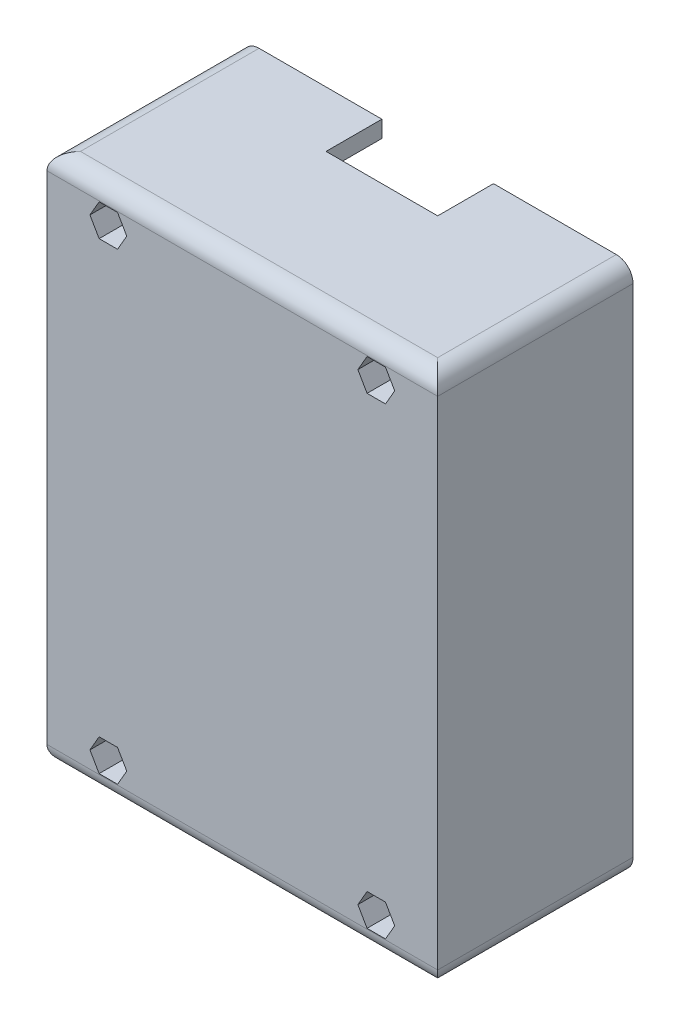
from build123d import *

# Parameters (mm, degrees)
SKETCH_1_W               = 35
SKETCH_1_H               = 95
EXTRUDE_1_DEPTH          = 60
CUT_EXTRUDE_1_DEPTH      = 32
SKETCH_5_R               = 1.6
CUT_EXTRUDE_2_DEPTH      = 85.150163399
SKETCH_6_W               = 35
SKETCH_6_H               = 95
EXTRUDE_2_DEPTH          = 5
SKETCH_7_W               = 35
SKETCH_7_H               = 95
EXTRUDE_3_DEPTH          = 5
SHELL_START              = -17.5
SHELL_1_DEPTH            = 32
SKETCH_8_W               = 8
SKETCH_8_H               = 7
SKETCH_8_R               = 1.530060118
EXTRUDE_4_DEPTH          = 5
SKETCH_9_W               = 2.5
SKETCH_9_H               = 5.5
CUT_EXTRUDE_3_DEPTH      = 7.5
SKETCH_10_W              = 2.5
SKETCH_10_H              = 5.5
CUT_EXTRUDE_4_DEPTH      = 8
SKETCH_11_W              = 5
SKETCH_11_H              = 5
EXTRUDE_5_DEPTH          = 16
CUT_EXTRUDE_5_DEPTH      = 40
CUT_EXTRUDE_5_DEPTH_BACK = 10
SKETCH_12_R              = 7
EXTRUDE_6_DEPTH          = 5
EXTRUDE_7_DEPTH          = 5
EXTRUDE_8_REACH          = 115.997
SKETCH_16_W              = 7
SKETCH_16_H              = 7
CUT_EXTRUDE_6_REACH      = 89.785
SKETCH_20_W              = 5.5
SKETCH_20_H              = 2.903315034
CUT_EXTRUDE_7_DEPTH      = 7
SKETCH_21_R              = 1.6
CUT_EXTRUDE_8_DEPTH      = 107.975985533
SKETCH_22_W              = 4
SKETCH_22_H              = 18
CUT_EXTRUDE_9_DEPTH      = 7
SKETCH_23_W              = 20
SKETCH_23_H              = 10
CUT_EXTRUDE_10_DEPTH     = 10
FILLET_3_R               = 3


# Read off the part's stored shape, not the designer's step: 抽壳1
with BuildPart() as part:
    # 草图1 → 凸台-拉伸1 (new body)
    with BuildSketch(Plane(origin=(0, 0, 0), x_dir=(0, 0, -1), z_dir=(1, 0, 0))):
        Rectangle(SKETCH_1_W, SKETCH_1_H)
    extrude(amount=EXTRUDE_1_DEPTH)

    # 草图4 → 切除-拉伸1 (cut)
    with BuildSketch(Plane.XY.offset(17.5)):
        Polygon((50.7, 41.5), (52.35, 38.642116168), (55.65, 38.642116168), (57.3, 41.5), (55.65, 44.357883832), (52.35, 44.357883832), align=None)
        Polygon((9.3, 41.5), (7.65, 44.357883832), (4.35, 44.357883832), (2.7, 41.5), (4.35, 38.642116168), (7.65, 38.642116168), align=None)
        Polygon((9.3, -41.5), (7.65, -38.642116168), (4.35, -38.642116168), (2.7, -41.5), (4.35, -44.357883832), (7.65, -44.357883832), align=None)
        Polygon((50.7, -41.5), (52.35, -44.357883832), (55.65, -44.357883832), (57.3, -41.5), (55.65, -38.642116168), (52.35, -38.642116168), align=None)
    extrude(amount=-CUT_EXTRUDE_1_DEPTH, mode=Mode.SUBTRACT)

    # 草图5 → 切除-拉伸2 (cut, through all)
    with BuildSketch(Plane.XY.offset(17.5)):
        with Locations((54, 41.5)):
            Circle(SKETCH_5_R)
        with Locations((6, 41.5)):
            Circle(SKETCH_5_R)
        with Locations((54, -41.5)):
            Circle(SKETCH_5_R)
        with Locations((6, -41.5)):
            Circle(SKETCH_5_R)
    extrude(amount=-CUT_EXTRUDE_2_DEPTH, mode=Mode.SUBTRACT)

    # 草图6 → 凸台-拉伸2 (add)
    with BuildSketch(Plane.ZY):
        Rectangle(SKETCH_6_W, SKETCH_6_H)
    extrude(amount=EXTRUDE_2_DEPTH)

    # 草图7 → 凸台-拉伸3 (add)
    with BuildSketch(Plane(origin=(60, 0, 0), x_dir=(0, 0, -1), z_dir=(1, 0, 0))):
        Rectangle(SKETCH_7_W, SKETCH_7_H)
    extrude(amount=EXTRUDE_3_DEPTH)

    # 抽壳1 outline → 抽壳1 (cut)
    with BuildSketch(Plane.XY.offset(SHELL_START)):
        Polygon((59.032050808, -44.5), (62, -44.5), (62, 44.5), (59.032050808, 44.5), (60.764101615, 41.5), (57.382050808, 35.642116168), (50.617949192, 35.642116168), (47.235898385, 41.5), (48.967949192, 44.5), (11.032050808, 44.5), (12.764101615, 41.5), (9.382050808, 35.642116168), (2.617949192, 35.642116168), (-0.764101615, 41.5), (0.967949192, 44.5), (-2, 44.5), (-2, -44.5), (0.967949192, -44.5), (-0.764101615, -41.5), (2.617949192, -35.642116168), (9.382050808, -35.642116168), (12.764101615, -41.5), (11.032050808, -44.5), (48.967949192, -44.5), (47.235898385, -41.5), (50.617949192, -35.642116168), (57.382050808, -35.642116168), (60.764101615, -41.5), align=None)
    extrude(amount=SHELL_1_DEPTH, mode=Mode.SUBTRACT)

    # 草图8 → 凸台-拉伸4 (add)
    # profile 1 of 4: a face of its own
    with BuildSketch(Plane(origin=(0, 0, -1.5), x_dir=(-1, 0, 0), z_dir=(0, 0, -1))):
        with Locations((-2, 32.5)):
            Rectangle(SKETCH_8_W, SKETCH_8_H)
        with Locations((-2, 32.5)):
            Circle(SKETCH_8_R, mode=Mode.SUBTRACT)
    # profile 2 of 4: a face of its own
    with BuildSketch(Plane(origin=(0, 0, -1.5), x_dir=(-1, 0, 0), z_dir=(0, 0, -1))):
        with Locations((-58, 32.5)):
            Rectangle(SKETCH_8_W, SKETCH_8_H)
        with Locations(Location((-58, 32.5, 0), (0, 0, 180))):
            Circle(SKETCH_8_R, mode=Mode.SUBTRACT)
    # profile 3 of 4: a face of its own
    with BuildSketch(Plane(origin=(0, 0, -1.5), x_dir=(-1, 0, 0), z_dir=(0, 0, -1))):
        with Locations((-2, -13.5)):
            Rectangle(SKETCH_8_W, SKETCH_8_H)
        with Locations(Location((-2, -13.5, 0), (0, 0, 180))):
            Circle(SKETCH_8_R, mode=Mode.SUBTRACT)
    # profile 4 of 4: a face of its own
    with BuildSketch(Plane(origin=(0, 0, -1.5), x_dir=(-1, 0, 0), z_dir=(0, 0, -1))):
        with Locations((-58, -13.5)):
            Rectangle(SKETCH_8_W, SKETCH_8_H)
        with Locations((-58, -13.5)):
            Circle(SKETCH_8_R, mode=Mode.SUBTRACT)
    extrude(amount=-EXTRUDE_4_DEPTH)

    # 草图9 → 切除-拉伸3 (cut)
    with BuildSketch(Plane.ZY.offset(-54)):
        with Locations((1.55, 32.5)):
            Rectangle(SKETCH_9_W, SKETCH_9_H)
        with Locations((1.55, -13.5)):
            Rectangle(SKETCH_9_W, SKETCH_9_H)
    extrude(amount=-CUT_EXTRUDE_3_DEPTH, mode=Mode.SUBTRACT)

    # 草图10 → 切除-拉伸4 (cut)
    with BuildSketch(Plane(origin=(6, 0, 0), x_dir=(0, 0, -1), z_dir=(1, 0, 0))):
        with Locations((-1.55, 32.5)):
            Rectangle(SKETCH_10_W, SKETCH_10_H)
        with Locations((-1.55, -13.5)):
            Rectangle(SKETCH_10_W, SKETCH_10_H)
    extrude(amount=-CUT_EXTRUDE_4_DEPTH, mode=Mode.SUBTRACT)

    # 草图11 → 凸台-拉伸5 (add)
    with BuildSketch(Plane(origin=(0, 0, 14.5), x_dir=(-1, 0, 0), z_dir=(0, 0, -1))):
        with Locations((-36.5, 32)):
            Rectangle(SKETCH_11_W, SKETCH_11_H)
        with Locations((-23.5, 32)):
            Rectangle(SKETCH_11_W, SKETCH_11_H)
        with Locations((-36.5, 2)):
            Rectangle(SKETCH_11_W, SKETCH_11_H)
        with Locations((-23.5, 2)):
            Rectangle(SKETCH_11_W, SKETCH_11_H)
    extrude(amount=EXTRUDE_5_DEPTH)

    # 草图12 → 切除-拉伸5 (cut, two sides: drawn at the far end of the back side and taken through both)
    with BuildSketch(Plane.XZ.offset(-29.5).offset(-CUT_EXTRUDE_5_DEPTH_BACK)):
        with Locations((30, 7.5)):
            Circle(SKETCH_12_R)
    extrude(amount=CUT_EXTRUDE_5_DEPTH + CUT_EXTRUDE_5_DEPTH_BACK, mode=Mode.SUBTRACT)

    # 草图13 → 凸台-拉伸6 (add)
    with BuildSketch(Plane.XZ.offset(-29.5)):
        Polygon((39, 4), (46, 14.5), (39, 14.5), align=None)
        Polygon((21, 6.5), (14, 14.5), (21, 14.5), align=None)
    extrude(amount=-EXTRUDE_6_DEPTH)

    # 草图15 → 凸台-拉伸7 (add)
    with BuildSketch(Plane.XZ.offset(0.5)):
        Polygon((39, 6.5), (46, 14.5), (39, 14.5), align=None)
        Polygon((21, 6.5), (21, 14.5), (14, 14.5), align=None)
    extrude(amount=-EXTRUDE_7_DEPTH)

    # 凸台-拉伸8: up to this face of the body (flat: up to its plane)
    extrude_8_end = Plane(part.part.faces().sort_by_distance((6, -35.642116168, -1.5))[0])
    # 草图16 → 凸台-拉伸8 (add, up to the picked face)
    with BuildSketch(Plane(origin=(0, -44.5, 0), x_dir=(1, 0, 0), z_dir=(0, 1, 0)), mode=Mode.PRIVATE) as extrude_8_sk1:
        with Locations((11.75, 1.5)):
            Rectangle(SKETCH_16_W, SKETCH_16_H)
    extrude_8_tool1 = split(extrude(extrude_8_sk1.sketch, amount=EXTRUDE_8_REACH, mode=Mode.PRIVATE), bisect_by=extrude_8_end, keep=Keep.BOTH, mode=Mode.PRIVATE)
    # 草图16 → 凸台-拉伸8 (add, up to the picked face)
    with BuildSketch(Plane(origin=(0, -44.5, 0), x_dir=(1, 0, 0), z_dir=(0, 1, 0)), mode=Mode.PRIVATE) as extrude_8_sk2:
        with Locations((48.25, 1.5)):
            Rectangle(SKETCH_16_W, SKETCH_16_H)
    extrude_8_tool2 = split(extrude(extrude_8_sk2.sketch, amount=EXTRUDE_8_REACH, mode=Mode.PRIVATE), bisect_by=extrude_8_end, keep=Keep.BOTH, mode=Mode.PRIVATE)
    add(extrude_8_tool1.solids().sort_by(Axis((11.75, -44.5, -1.5), (0, 1, 0)))[0])
    add(extrude_8_tool2.solids().sort_by(Axis((48.25, -44.5, -1.5), (0, 1, 0)))[0])

    # 草图19 → 切除-拉伸6 (cut, up to next)
    with BuildSketch(Plane.XY.offset(17.5), mode=Mode.PRIVATE) as cut_extrude_6_sk1:
        Polygon((4.35, -44.357883832), (7.65, -44.357883832), (8.25, -43.318653348), (9.3, -41.5), (8.25, -39.681346652), (7.65, -38.642116168), (4.35, -38.642116168), (2.7, -41.5), align=None)
    cut_extrude_6_tool1 = extrude(cut_extrude_6_sk1.sketch, amount=-CUT_EXTRUDE_6_REACH, mode=Mode.PRIVATE) & part.part
    # 草图19 → 切除-拉伸6 (cut, up to next)
    with BuildSketch(Plane.XY.offset(17.5), mode=Mode.PRIVATE) as cut_extrude_6_sk2:
        Polygon((52.35, -44.357883832), (50.7, -41.5), (52.35, -38.642116168), (55.65, -38.642116168), (57.3, -41.5), (55.65, -44.357883832), align=None)
    cut_extrude_6_tool2 = extrude(cut_extrude_6_sk2.sketch, amount=-CUT_EXTRUDE_6_REACH, mode=Mode.PRIVATE) & part.part
    add(cut_extrude_6_tool1.solids().sort_by_distance((6, -41.5, 17.5))[0], mode=Mode.SUBTRACT)
    add(cut_extrude_6_tool2.solids().sort_by_distance((54, -41.5, 17.5))[0], mode=Mode.SUBTRACT)

    # 草图20 → 切除-拉伸7 (cut)
    with BuildSketch(Plane(origin=(15.25, 0, 0), x_dir=(0, 0, -1), z_dir=(1, 0, 0))):
        with Locations((1.5, -38.693773685)):
            Rectangle(SKETCH_20_W, SKETCH_20_H)
    cut_extrude_7 = extrude(amount=-CUT_EXTRUDE_7_DEPTH, mode=Mode.SUBTRACT)

    # 镜向3: 切除-拉伸7 across plane
    add(cut_extrude_7.mirror(Plane(origin=(30, 0, 0), x_dir=(0, 0, 1), z_dir=(1, 0, 0))), mode=Mode.SUBTRACT)

    # 草图21 → 切除-拉伸8 (cut, through all)
    with BuildSketch(Plane(origin=(0, -35.642116168, 0), x_dir=(1, 0, 0), z_dir=(0, 1, 0))):
        with Locations(Location((48.25, 1.5, 0), (0, 0, 270))):
            Circle(SKETCH_21_R)
        with Locations(Location((11.75, 1.5, 0), (0, 0, 270))):
            Circle(SKETCH_21_R)
    extrude(amount=-CUT_EXTRUDE_8_DEPTH, mode=Mode.SUBTRACT)

    # 草图22 → 切除-拉伸9 (cut)
    with BuildSketch(Plane.XZ.offset(47.5)):
        with Locations((21.75, -0.5)):
            Rectangle(SKETCH_22_W, SKETCH_22_H)
        with Locations((30, -0.5)):
            Rectangle(SKETCH_22_W, SKETCH_22_H)
        with Locations((38.25, -0.5)):
            Rectangle(SKETCH_22_W, SKETCH_22_H)
    extrude(amount=-CUT_EXTRUDE_9_DEPTH, mode=Mode.SUBTRACT)

    # 草图23 → 切除-拉伸10 (cut)
    with BuildSketch(Plane(origin=(0, 47.5, 0), x_dir=(1, 0, 0), z_dir=(0, 1, 0))):
        with Locations((30, 12.5)):
            Rectangle(SKETCH_23_W, SKETCH_23_H)
    extrude(amount=-CUT_EXTRUDE_10_DEPTH, mode=Mode.SUBTRACT)

    # 圆角3
    fillet_3_edges = [part.edges().sort_by_distance(p)[0] for p in [
        (-5, 47.5, 0),
        (-5, -47.5, 0),
        (65, -47.5, 0),
        (65, 47.5, 0),
        (30, -47.5, 17.5),
        (30, 47.5, 17.5),
    ]]
    fillet(fillet_3_edges, radius=FILLET_3_R)


solid = part.part
